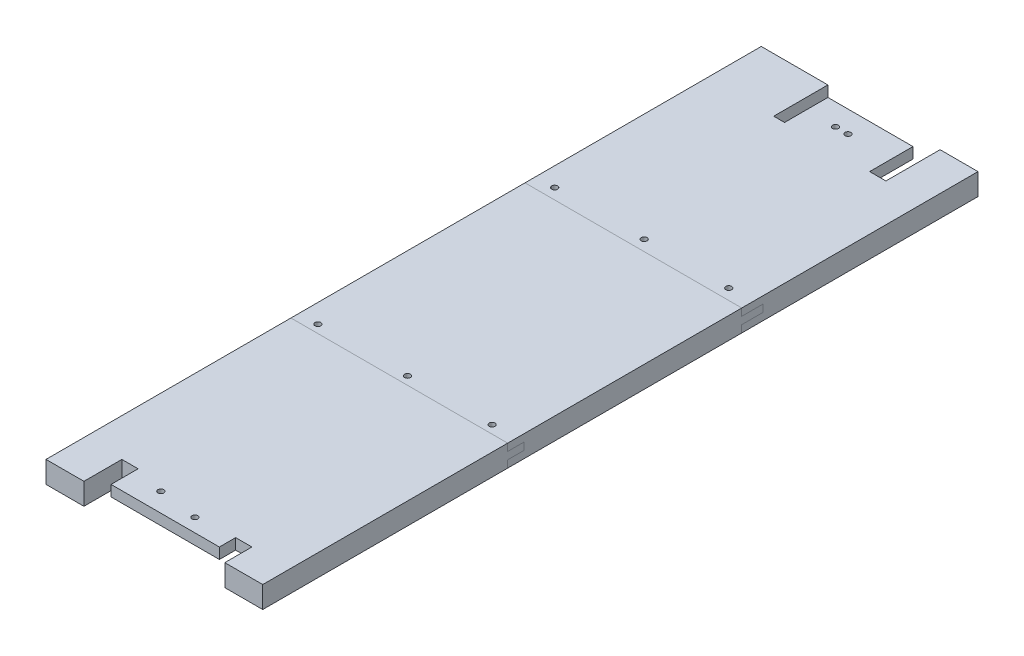
from build123d import *

# Parameters (mm, degrees)
BOSS_EXTRUDE1_DEPTH     = 10
CUT_EXTRUDE1_DEPTH      = 371.163218123
CUT_EXTRUDE1_DEPTH_BACK = 371.163218123
SKETCH2_W               = 11.607476636
SKETCH2_H               = 200
SKETCH3_W               = 10
SKETCH3_H               = 200
BOSS_EXTRUDE2_DEPTH     = 10
SKETCH4_W               = 1.61
SKETCH4_H               = 200
BOSS_EXTRUDE3_DEPTH     = 10
SKETCH5_W               = 69.002523364
SKETCH5_H               = 10
BOSS_EXTRUDE4_DEPTH     = 20
CUT_EXTRUDE2_DEPTH      = 371.163218123
CUT_EXTRUDE2_DEPTH_BACK = 371.163218123
SKETCH6_W               = 40
SKETCH6_H               = 10
SKETCH8_W               = 9.997476636
SKETCH8_H               = 10
SKETCH8_W_2             = 20
BOSS_EXTRUDE6_DEPTH     = 10
CUT_EXTRUDE3_DEPTH      = 371.163218123
CUT_EXTRUDE3_DEPTH_BACK = 371.163218123
SKETCH9_W               = 2.5
SKETCH9_H               = 210
CUT_EXTRUDE4_DEPTH      = 371.163218123
CUT_EXTRUDE4_DEPTH_BACK = 371.163218123
SKETCH10_W              = 2.5
SKETCH10_H              = 340
CUT_EXTRUDE5_DEPTH      = 370.580972771
CUT_EXTRUDE5_DEPTH_BACK = 370.580972771
SKETCH11_W              = 2.5
SKETCH11_H              = 110
SKETCH12_W              = 110
SKETCH12_H              = 10
BOSS_EXTRUDE7_DEPTH     = 43.5
SKETCH13_W              = 340
SKETCH13_H              = 10
BOSS_EXTRUDE8_DEPTH     = 3.5
SKETCH14_W              = 210
SKETCH14_H              = 10
BOSS_EXTRUDE9_DEPTH     = 2
SKETCH15_W              = 9.997476636
SKETCH15_H              = 210
BOSS_EXTRUDE10_DEPTH    = 10
CUT_EXTRUDE6_DEPTH      = 371.400584635
CUT_EXTRUDE6_DEPTH_BACK = 371.400584635
SKETCH16_W              = 21.5
SKETCH16_H              = 46.5
CUT_EXTRUDE7_DEPTH      = 371.400584635
CUT_EXTRUDE7_DEPTH_BACK = 371.400584635
SKETCH18_W              = 78.5
SKETCH18_H              = 10
SKETCH18_W_2            = 100
SKETCH19_R              = 2.7
CUT_EXTRUDE8_DEPTH      = 361.701253357
SKETCH20_R              = 2.7
CUT_EXTRUDE9_DEPTH      = 361.701253357
BOSS_EXTRUDE13_DEPTH    = 10
SKETCH24_W              = 206.5
SKETCH24_H              = 20
BOSS_EXTRUDE14_DEPTH    = 21.5
BOSS_EXTRUDE15_DEPTH    = 15
SKETCH27_W              = 575
SKETCH27_H              = 20
BOSS_EXTRUDE17_DEPTH    = 15
SKETCH28_W              = 26.5
SKETCH28_H              = 20
BOSS_EXTRUDE18_DEPTH    = 50
SKETCH30_W              = 650
SKETCH30_H              = 20
BOSS_EXTRUDE19_DEPTH    = 35
SKETCH31_W              = 650
SKETCH31_H              = 20
BOSS_EXTRUDE20_DEPTH    = 35
SKETCH35_R              = 2.7
CUT_EXTRUDE10_DEPTH     = 377.489902268
SPLIT1_START            = -10
SPLIT1_DEPTH            = 20
SPLIT1_START_2          = 3.34
SPLIT1_2_OUTLINE_W      = 200
SPLIT1_2_OUTLINE_H      = 19.838597034
SPLIT1_2_OUTLINE_R      = 2.7
SPLIT1_2_OUTLINE_W_2    = 78.5
SPLIT1_2_OUTLINE_H_2    = 40
SPLIT1_2_DEPTH          = 6.66
SPLIT1_3_OUTLINE_W      = 200
SPLIT1_3_OUTLINE_H      = 19.838597034
SPLIT1_3_OUTLINE_R      = 2.7
SPLIT1_3_DEPTH          = 6.66
SPLIT1_4_OUTLINE_W      = 78.5
SPLIT1_4_OUTLINE_H      = 40
SPLIT1_4_OUTLINE_R      = 2.7
SPLIT1_4_DEPTH          = 3.34
SPLIT1_5_OUTLINE_W      = 200
SPLIT1_5_OUTLINE_H      = 201
SPLIT1_5_DEPTH          = 20
SPLIT1_START_3          = -3.34
SPLIT1_6_OUTLINE_W      = 200
SPLIT1_6_OUTLINE_H      = 19.838597034
SPLIT1_6_OUTLINE_R      = 2.7
SPLIT1_6_DEPTH          = 6.68
SPLIT1_7_OUTLINE_W      = 200
SPLIT1_7_OUTLINE_H      = 15
SPLIT1_7_OUTLINE_R      = 2.7
SPLIT1_7_DEPTH          = 6.66
SPLIT1_8_OUTLINE_W      = 200
SPLIT1_8_OUTLINE_H      = 15
SPLIT1_8_OUTLINE_R      = 2.7
SPLIT1_8_DEPTH          = 6.66
SPLIT1_9_OUTLINE_R      = 2.7
SPLIT1_9_DEPTH          = 20
SPLIT1_10_OUTLINE_W     = 200
SPLIT1_10_OUTLINE_H     = 15
SPLIT1_10_OUTLINE_R     = 2.7
SPLIT1_10_DEPTH         = 6.66
SPLIT1_11_OUTLINE_W     = 200
SPLIT1_11_OUTLINE_H     = 15
SPLIT1_11_OUTLINE_R     = 2.7
SPLIT1_11_DEPTH         = 6.66
SKETCH36_W              = 35
SKETCH36_H              = 20
BOSS_EXTRUDE21_DEPTH    = 10
SKETCH37_R              = 7.5
SKETCH37_R_2            = 7.211748486
SKETCH37_R_3            = 6
CUT_EXTRUDE11_DEPTH     = 10


# Read off the part's stored shape, not the designer's step: Split1
with BuildPart() as part:
    # Sketch1 → Boss-Extrude1 (new body)
    with BuildSketch(Plane(origin=(0, 0, 0), x_dir=(1, 0, 0), z_dir=(0, 1, 0))):
        Polygon((-57.392523364, 280.440053801), (11.607476636, 280.440053801), (11.607476636, 80.440053801), (11.607476636, -259.559946199), (11.607476636, -359.559946199), (-47.392523364, -359.559946199), (-47.392523364, -259.559946199), (-87.392523364, -259.559946199), (-87.392523364, 80.440053801), (-57.392523364, 80.440053801), align=None)
    extrude(amount=BOSS_EXTRUDE1_DEPTH)

    # Sketch2 → Cut-Extrude1 (cut, two sides: drawn at the far end of the back side and taken through both)
    with BuildSketch(Plane(origin=(0, 10, 0), x_dir=(1, 0, 0), z_dir=(0, 1, 0)).offset(-CUT_EXTRUDE1_DEPTH_BACK)):
        with Locations((5.803738318, 180.440053801)):
            Rectangle(SKETCH2_W, SKETCH2_H)
    extrude(amount=CUT_EXTRUDE1_DEPTH + CUT_EXTRUDE1_DEPTH_BACK, mode=Mode.SUBTRACT)

    # Sketch3 → Boss-Extrude2 (add)
    with BuildSketch(Plane(origin=(0, 10, 0), x_dir=(1, 0, 0), z_dir=(0, 1, 0))):
        with Locations((-62.392523364, 180.440053801)):
            Rectangle(SKETCH3_W, SKETCH3_H)
    extrude(amount=-BOSS_EXTRUDE2_DEPTH)

    # Sketch4 → Boss-Extrude3 (add)
    with BuildSketch(Plane(origin=(0, 10, 0), x_dir=(1, 0, 0), z_dir=(0, 1, 0))):
        with Locations((0.805, 180.440053801)):
            Rectangle(SKETCH4_W, SKETCH4_H)
    extrude(amount=-BOSS_EXTRUDE3_DEPTH)

    # Sketch5 → Boss-Extrude4 (add)
    with BuildSketch(Plane(origin=(0, 0, -280.440053801), x_dir=(-1, 0, 0), z_dir=(0, 0, -1))):
        with Locations((32.891261682, 5)):
            Rectangle(SKETCH5_W, SKETCH5_H)
    extrude(amount=BOSS_EXTRUDE4_DEPTH)

    # Sketch6 → Cut-Extrude2 (cut, two sides: drawn at the far end of the back side and taken through both)
    with BuildSketch(Plane(origin=(0, 10, 0), x_dir=(1, 0, 0), z_dir=(0, 1, 0)).offset(-CUT_EXTRUDE2_DEPTH_BACK)):
        with Locations((-67.392523364, -254.559946199)):
            Rectangle(SKETCH6_W, SKETCH6_H)
    extrude(amount=CUT_EXTRUDE2_DEPTH + CUT_EXTRUDE2_DEPTH_BACK, mode=Mode.SUBTRACT)

    # Sketch8 → Boss-Extrude6 (add)
    with BuildSketch(Plane(origin=(0, 0, -80.440053801), x_dir=(-1, 0, 0), z_dir=(0, 0, -1))):
        with Locations((-6.608738318, 5)):
            Rectangle(SKETCH8_W, SKETCH8_H)
        with Locations((77.392523364, 5)):
            Rectangle(SKETCH8_W_2, SKETCH8_H)
    extrude(amount=BOSS_EXTRUDE6_DEPTH)

    # Sketch9 → Cut-Extrude3 (cut, two sides: drawn at the far end of the back side and taken through both)
    with BuildSketch(Plane(origin=(0, 10, 0), x_dir=(1, 0, 0), z_dir=(0, 1, 0)).offset(-CUT_EXTRUDE3_DEPTH_BACK)):
        with Locations((-66.142523364, 195.440053801)):
            Rectangle(SKETCH9_W, SKETCH9_H)
    extrude(amount=CUT_EXTRUDE3_DEPTH + CUT_EXTRUDE3_DEPTH_BACK, mode=Mode.SUBTRACT)

    # Sketch10 → Cut-Extrude4 (cut, two sides: drawn at the far end of the back side and taken through both)
    with BuildSketch(Plane(origin=(0, 10, 0), x_dir=(1, 0, 0), z_dir=(0, 1, 0)).offset(-CUT_EXTRUDE4_DEPTH_BACK)):
        with Locations((-86.142523364, -79.559946199)):
            Rectangle(SKETCH10_W, SKETCH10_H)
    extrude(amount=CUT_EXTRUDE4_DEPTH + CUT_EXTRUDE4_DEPTH_BACK, mode=Mode.SUBTRACT)

    # Sketch11 → Cut-Extrude5 (cut, two sides: drawn at the far end of the back side and taken through both)
    with BuildSketch(Plane(origin=(0, 10, 0), x_dir=(1, 0, 0), z_dir=(0, 1, 0)).offset(-CUT_EXTRUDE5_DEPTH_BACK)):
        with Locations((-46.142523364, -304.559946199)):
            Rectangle(SKETCH11_W, SKETCH11_H)
    extrude(amount=CUT_EXTRUDE5_DEPTH + CUT_EXTRUDE5_DEPTH_BACK, mode=Mode.SUBTRACT)

    # Sketch12 → Boss-Extrude7 (add)
    with BuildSketch(Plane.ZY.offset(44.892523364)):
        with Locations((304.559946199, 5)):
            Rectangle(SKETCH12_W, SKETCH12_H)
    extrude(amount=BOSS_EXTRUDE7_DEPTH)

    # Sketch13 → Boss-Extrude8 (add)
    with BuildSketch(Plane.ZY.offset(84.892523364)):
        with Locations((79.559946199, 5)):
            Rectangle(SKETCH13_W, SKETCH13_H)
    extrude(amount=BOSS_EXTRUDE8_DEPTH)

    # Sketch14 → Boss-Extrude9 (add)
    with BuildSketch(Plane.ZY.offset(64.892523364)):
        with Locations((-195.440053801, 5)):
            Rectangle(SKETCH14_W, SKETCH14_H)
    extrude(amount=BOSS_EXTRUDE9_DEPTH)

    # Sketch15 → Boss-Extrude10 (add)
    with BuildSketch(Plane(origin=(0, 10, 0), x_dir=(1, 0, 0), z_dir=(0, 1, 0))):
        with Locations((6.608738318, 195.440053801)):
            Rectangle(SKETCH15_W, SKETCH15_H)
    extrude(amount=-BOSS_EXTRUDE10_DEPTH)

    # Sketch16 → Cut-Extrude6 (cut, two sides: drawn at the far end of the back side and taken through both)
    with BuildSketch(Plane(origin=(0, 10, 0), x_dir=(1, 0, 0), z_dir=(0, 1, 0)).offset(-CUT_EXTRUDE6_DEPTH_BACK)):
        with Locations((-77.642523364, 67.190053801)):
            Rectangle(SKETCH16_W, SKETCH16_H)
    extrude(amount=CUT_EXTRUDE6_DEPTH + CUT_EXTRUDE6_DEPTH_BACK, mode=Mode.SUBTRACT)

    # Sketch18 → Cut-Extrude7 (cut, two sides: drawn at the far end of the back side and taken through both)
    with BuildSketch(Plane(origin=(0, 10, 0), x_dir=(1, 0, 0), z_dir=(0, 1, 0)).offset(-CUT_EXTRUDE7_DEPTH_BACK)):
        with Locations((-27.642523364, 295.440053801)):
            Rectangle(SKETCH18_W, SKETCH18_H)
        with Locations((-38.392523364, -354.559946199)):
            Rectangle(SKETCH18_W_2, SKETCH18_H)
    extrude(amount=CUT_EXTRUDE7_DEPTH + CUT_EXTRUDE7_DEPTH_BACK, mode=Mode.SUBTRACT)

    # Sketch19 → Cut-Extrude8 (cut, through all)
    with BuildSketch(Plane(origin=(0, 10, 0), x_dir=(1, 0, 0), z_dir=(0, 1, 0))):
        with Locations(Location((-23.392523364, -337.159946199, 0), (0, 0, 270))):
            Circle(SKETCH19_R)
        with Locations(Location((-59.892523364, -332.059946199, 0), (0, 0, 270))):
            Circle(SKETCH19_R)
    extrude(amount=-CUT_EXTRUDE8_DEPTH, mode=Mode.SUBTRACT)

    # Sketch20 → Cut-Extrude9 (cut, through all)
    with BuildSketch(Plane.XZ):
        with Locations(Location((-39.892523364, -270.440053801, 0), (0, 0, 270))):
            Circle(SKETCH20_R)
        with Locations(Location((-28.392523364, -270.440053801, 0), (0, 0, 270))):
            Circle(SKETCH20_R)
    extrude(amount=-CUT_EXTRUDE9_DEPTH, mode=Mode.SUBTRACT)

    # Sketch21 → Boss-Extrude13 (add)
    with BuildSketch(Plane.XZ):
        Polygon((11.607476636, 324.559946199), (-88.392523364, 324.559946199), (-88.392523364, -43.940053801), (-66.892523364, -43.940053801), (-66.892523364, -250.440053801), (11.607476636, -250.440053801), align=None)
    extrude(amount=BOSS_EXTRUDE13_DEPTH)

    # Sketch24 → Boss-Extrude14 (add)
    with BuildSketch(Plane.ZY.offset(66.892523364)):
        with Locations((-147.190053801, 0)):
            Rectangle(SKETCH24_W, SKETCH24_H)
    extrude(amount=BOSS_EXTRUDE14_DEPTH)

    # Sketch25 → Boss-Extrude15 (add)
    with BuildSketch(Plane(origin=(11.607476636, 0, 0), x_dir=(0, 0, -1), z_dir=(1, 0, 0))):
        Polygon((250.440053801, -10), (-324.559946199, -10), (-324.559946199, 0), (-334.559946199, 0), (-334.559946199, 10), (-324.559946199, 10), (250.440053801, 10), (250.440053801, 0), align=None)
    extrude(amount=BOSS_EXTRUDE15_DEPTH)

    # Sketch27 → Boss-Extrude17 (add)
    with BuildSketch(Plane.ZY.offset(88.392523364)):
        with Locations((37.059946199, 0)):
            Rectangle(SKETCH27_W, SKETCH27_H)
    extrude(amount=BOSS_EXTRUDE17_DEPTH)

    # Sketch28 → Boss-Extrude18 (add)
    with BuildSketch(Plane(origin=(0, 0, -250.440053801), x_dir=(-1, 0, 0), z_dir=(0, 0, -1))):
        with Locations((90.142523364, 0)):
            Rectangle(SKETCH28_W, SKETCH28_H)
    extrude(amount=BOSS_EXTRUDE18_DEPTH)

    # Sketch30 → Boss-Extrude19 (add)
    with BuildSketch(Plane.ZY.offset(103.392523364)):
        with Locations((24.559946199, 0)):
            Rectangle(SKETCH30_W, SKETCH30_H)
    extrude(amount=BOSS_EXTRUDE19_DEPTH)

    # Sketch31 → Boss-Extrude20 (add)
    with BuildSketch(Plane(origin=(26.607476636, 0, 0), x_dir=(0, 0, -1), z_dir=(1, 0, 0))):
        with Locations((-24.559946199, 0)):
            Rectangle(SKETCH31_W, SKETCH31_H)
    extrude(amount=BOSS_EXTRUDE20_DEPTH)

    # Sketch35 → Cut-Extrude10 (cut, through all)
    with BuildSketch(Plane(origin=(0, 10, 0), x_dir=(1, 0, 0), z_dir=(0, 1, 0))):
        with Locations(Location((-120.938694043, 92.359352318, 0), (0, 0, 270))):
            Circle(SKETCH35_R)
        with Locations(Location((-38.392523364, 92.359352318, 0), (0, 0, 270))):
            Circle(SKETCH35_R)
        with Locations(Location((39.694940335, 92.359352318, 0), (0, 0, 270))):
            Circle(SKETCH35_R)
        with Locations(Location((-120.938694043, -126.059946199, 0), (0, 0, 270))):
            Circle(SKETCH35_R)
        with Locations(Location((-38.392523364, -126.059946199, 0), (0, 0, 270))):
            Circle(SKETCH35_R)
        with Locations(Location((39.694940335, -126.059946199, 0), (0, 0, 270))):
            Circle(SKETCH35_R)
    extrude(amount=-CUT_EXTRUDE10_DEPTH, mode=Mode.SUBTRACT)

    # Split1 9 outline → Split1 9 (cut)
    with BuildSketch(Plane(origin=(0, 0, 0), x_dir=(1, 0, 0), z_dir=(0, 1, 0)).offset(SPLIT1_START)):
        Polygon((-138.392523364, 300.440053801), (-138.392523364, -118.559946199), (61.607476636, -118.559946199), (61.607476636, 300.440053801), (26.607476636, 300.440053801), (26.607476636, 250.440053801), (11.607476636, 250.440053801), (11.607476636, 290.440053801), (-66.892523364, 290.440053801), (-66.892523364, 250.440053801), (-76.892523364, 250.440053801), (-76.892523364, 300.440053801), align=None)
        with Locations((-120.938694043, 92.359352318)):
            Circle(SPLIT1_9_OUTLINE_R, mode=Mode.SUBTRACT)
        with Locations((-38.392523364, 92.359352318)):
            Circle(SPLIT1_9_OUTLINE_R, mode=Mode.SUBTRACT)
        with Locations((39.694940335, 92.359352318)):
            Circle(SPLIT1_9_OUTLINE_R, mode=Mode.SUBTRACT)
        with Locations((-28.392523364, 270.440053801)):
            Circle(SPLIT1_9_OUTLINE_R, mode=Mode.SUBTRACT)
        with Locations((-39.892523364, 270.440053801)):
            Circle(SPLIT1_9_OUTLINE_R, mode=Mode.SUBTRACT)
    extrude(amount=SPLIT1_9_DEPTH, mode=Mode.SUBTRACT)

    # Split1 10 outline → Split1 10 (cut)
    with BuildSketch(Plane(origin=(0, 0, 0), x_dir=(1, 0, 0), z_dir=(0, 1, 0)).offset(SPLIT1_START)):
        with Locations((-38.392523364, -126.059946199)):
            Rectangle(SPLIT1_10_OUTLINE_W, SPLIT1_10_OUTLINE_H)
        with Locations((-120.938694043, -126.059946199)):
            Circle(SPLIT1_10_OUTLINE_R, mode=Mode.SUBTRACT)
        with Locations((-38.392523364, -126.059946199)):
            Circle(SPLIT1_10_OUTLINE_R, mode=Mode.SUBTRACT)
        with Locations((39.694940335, -126.059946199)):
            Circle(SPLIT1_10_OUTLINE_R, mode=Mode.SUBTRACT)
    extrude(amount=SPLIT1_10_DEPTH, mode=Mode.SUBTRACT)

    # Split1 11 outline → Split1 11 (cut)
    with BuildSketch(Plane(origin=(0, 0, 0), x_dir=(1, 0, 0), z_dir=(0, 1, 0)).offset(SPLIT1_START_2)):
        with Locations((-38.392523364, -126.059946199)):
            Rectangle(SPLIT1_11_OUTLINE_W, SPLIT1_11_OUTLINE_H)
        with Locations((-120.938694043, -126.059946199)):
            Circle(SPLIT1_11_OUTLINE_R, mode=Mode.SUBTRACT)
        with Locations((-38.392523364, -126.059946199)):
            Circle(SPLIT1_11_OUTLINE_R, mode=Mode.SUBTRACT)
        with Locations((39.694940335, -126.059946199)):
            Circle(SPLIT1_11_OUTLINE_R, mode=Mode.SUBTRACT)
    extrude(amount=SPLIT1_11_DEPTH, mode=Mode.SUBTRACT)

    # Sketch36 → Boss-Extrude21 (add)
    with BuildSketch(Plane.XY.offset(349.559946199)):
        with Locations((-120.892523364, 0)):
            Rectangle(SKETCH36_W, SKETCH36_H)
        with Locations((44.107476636, 0)):
            Rectangle(SKETCH36_W, SKETCH36_H)
    extrude(amount=BOSS_EXTRUDE21_DEPTH)


with BuildPart() as body_2:
    # Split1 outline → Split1 (new body)
    with BuildSketch(Plane(origin=(0, 0, 0), x_dir=(1, 0, 0), z_dir=(0, 1, 0)).offset(SPLIT1_START)):
        Polygon((-138.392523364, 300.440053801), (-138.392523364, 102.278650835), (61.607476636, 102.278650835), (61.607476636, 300.440053801), (26.607476636, 300.440053801), (26.607476636, 250.440053801), (-76.892523364, 250.440053801), (-76.892523364, 300.440053801), align=None)
    extrude(amount=SPLIT1_DEPTH)

    # Split1 2 outline → Split1 2 (add)
    # profile 1 of 2: a face of its own
    with BuildSketch(Plane(origin=(0, 0, 0), x_dir=(1, 0, 0), z_dir=(0, 1, 0)).offset(SPLIT1_START_2)):
        with Locations((-38.392523364, 92.359352318)):
            Rectangle(SPLIT1_2_OUTLINE_W, SPLIT1_2_OUTLINE_H)
        with Locations((-120.938694043, 92.359352318)):
            Circle(SPLIT1_2_OUTLINE_R, mode=Mode.SUBTRACT)
        with Locations((-38.392523364, 92.359352318)):
            Circle(SPLIT1_2_OUTLINE_R, mode=Mode.SUBTRACT)
        with Locations((39.694940335, 92.359352318)):
            Circle(SPLIT1_2_OUTLINE_R, mode=Mode.SUBTRACT)
    # profile 2 of 2: a face of its own
    with BuildSketch(Plane(origin=(0, 0, 0), x_dir=(1, 0, 0), z_dir=(0, 1, 0)).offset(SPLIT1_START_2)):
        with Locations((-27.642523364, 270.440053801)):
            Rectangle(SPLIT1_2_OUTLINE_W_2, SPLIT1_2_OUTLINE_H_2)
        with Locations((-39.892523364, 270.440053801)):
            Circle(SPLIT1_2_OUTLINE_R, mode=Mode.SUBTRACT)
        with Locations((-28.392523364, 270.440053801)):
            Circle(SPLIT1_2_OUTLINE_R, mode=Mode.SUBTRACT)
    extrude(amount=SPLIT1_2_DEPTH)

    # Split1 3 outline → Split1 3 (add)
    with BuildSketch(Plane(origin=(0, 0, 0), x_dir=(1, 0, 0), z_dir=(0, 1, 0)).offset(SPLIT1_START)):
        with Locations((-38.392523364, 92.359352318)):
            Rectangle(SPLIT1_3_OUTLINE_W, SPLIT1_3_OUTLINE_H)
        with Locations((-120.938694043, 92.359352318)):
            Circle(SPLIT1_3_OUTLINE_R, mode=Mode.SUBTRACT)
        with Locations((-38.392523364, 92.359352318)):
            Circle(SPLIT1_3_OUTLINE_R, mode=Mode.SUBTRACT)
        with Locations((39.694940335, 92.359352318)):
            Circle(SPLIT1_3_OUTLINE_R, mode=Mode.SUBTRACT)
    extrude(amount=SPLIT1_3_DEPTH)

    # Split1 4 outline → Split1 4 (add)
    with BuildSketch(Plane(origin=(0, 0, 0), x_dir=(1, 0, 0), z_dir=(0, 1, 0))):
        with Locations((-27.642523364, 270.440053801)):
            Rectangle(SPLIT1_4_OUTLINE_W, SPLIT1_4_OUTLINE_H)
        with Locations((-39.892523364, 270.440053801)):
            Circle(SPLIT1_4_OUTLINE_R, mode=Mode.SUBTRACT)
        with Locations((-28.392523364, 270.440053801)):
            Circle(SPLIT1_4_OUTLINE_R, mode=Mode.SUBTRACT)
    extrude(amount=SPLIT1_4_DEPTH)


with BuildPart() as body_3:
    # Split1 5 outline → Split1 5 (new body)
    with BuildSketch(Plane(origin=(0, 0, 0), x_dir=(1, 0, 0), z_dir=(0, 1, 0)).offset(SPLIT1_START)):
        with Locations((-38.392523364, -18.059946199)):
            Rectangle(SPLIT1_5_OUTLINE_W, SPLIT1_5_OUTLINE_H)
    extrude(amount=SPLIT1_5_DEPTH)

    # Split1 6 outline → Split1 6 (add)
    with BuildSketch(Plane(origin=(0, 0, 0), x_dir=(1, 0, 0), z_dir=(0, 1, 0)).offset(SPLIT1_START_3)):
        with Locations((-38.392523364, 92.359352318)):
            Rectangle(SPLIT1_6_OUTLINE_W, SPLIT1_6_OUTLINE_H)
        with Locations((-120.938694043, 92.359352318)):
            Circle(SPLIT1_6_OUTLINE_R, mode=Mode.SUBTRACT)
        with Locations((-38.392523364, 92.359352318)):
            Circle(SPLIT1_6_OUTLINE_R, mode=Mode.SUBTRACT)
        with Locations((39.694940335, 92.359352318)):
            Circle(SPLIT1_6_OUTLINE_R, mode=Mode.SUBTRACT)
    extrude(amount=SPLIT1_6_DEPTH)

    # Split1 7 outline → Split1 7 (add)
    with BuildSketch(Plane(origin=(0, 0, 0), x_dir=(1, 0, 0), z_dir=(0, 1, 0)).offset(SPLIT1_START)):
        with Locations((-38.392523364, -126.059946199)):
            Rectangle(SPLIT1_7_OUTLINE_W, SPLIT1_7_OUTLINE_H)
        with Locations((-120.938694043, -126.059946199)):
            Circle(SPLIT1_7_OUTLINE_R, mode=Mode.SUBTRACT)
        with Locations((-38.392523364, -126.059946199)):
            Circle(SPLIT1_7_OUTLINE_R, mode=Mode.SUBTRACT)
        with Locations((39.694940335, -126.059946199)):
            Circle(SPLIT1_7_OUTLINE_R, mode=Mode.SUBTRACT)
    extrude(amount=SPLIT1_7_DEPTH)

    # Split1 8 outline → Split1 8 (add)
    with BuildSketch(Plane(origin=(0, 0, 0), x_dir=(1, 0, 0), z_dir=(0, 1, 0)).offset(SPLIT1_START_2)):
        with Locations((-38.392523364, -126.059946199)):
            Rectangle(SPLIT1_8_OUTLINE_W, SPLIT1_8_OUTLINE_H)
        with Locations((-120.938694043, -126.059946199)):
            Circle(SPLIT1_8_OUTLINE_R, mode=Mode.SUBTRACT)
        with Locations((-38.392523364, -126.059946199)):
            Circle(SPLIT1_8_OUTLINE_R, mode=Mode.SUBTRACT)
        with Locations((39.694940335, -126.059946199)):
            Circle(SPLIT1_8_OUTLINE_R, mode=Mode.SUBTRACT)
    extrude(amount=SPLIT1_8_DEPTH)


with BuildPart() as cut_extrude11_tool:
    # Sketch37 → Cut-Extrude11 (new body)
    with BuildSketch(Plane.XZ.offset(10)):
        with Locations(Location((-120.938694043, -92.359352318, 0), (0, 0, 270))):
            Circle(SKETCH37_R)
        with Locations(Location((-38.392523364, -92.359352318, 0), (0, 0, 270))):
            Circle(SKETCH37_R_2)
        with Locations(Location((39.694940335, -92.359352318, 0), (0, 0, 270))):
            Circle(SKETCH37_R)
        with Locations(Location((-120.938694043, 126.059946199, 0), (0, 0, 270))):
            Circle(SKETCH37_R_3)
        with Locations(Location((-38.392523364, 126.059946199, 0), (0, 0, 270))):
            Circle(SKETCH37_R_3)
        with Locations(Location((39.694940335, 126.059946199, 0), (0, 0, 270))):
            Circle(SKETCH37_R_3)
    extrude(amount=-CUT_EXTRUDE11_DEPTH)


with BuildPart() as part_1:
    add(part.part)

    # Cut-Extrude11: cut by cut_extrude11_tool
    add(cut_extrude11_tool.part, mode=Mode.SUBTRACT)


with BuildPart() as body_2_1:
    add(body_2.part)

    # Cut-Extrude11: cut by cut_extrude11_tool
    add(cut_extrude11_tool.part, mode=Mode.SUBTRACT)


with BuildPart() as body_3_1:
    add(body_3.part)

    # Cut-Extrude11: cut by cut_extrude11_tool
    add(cut_extrude11_tool.part, mode=Mode.SUBTRACT)


solid = Compound([part_1.part, body_2_1.part, body_3_1.part])
